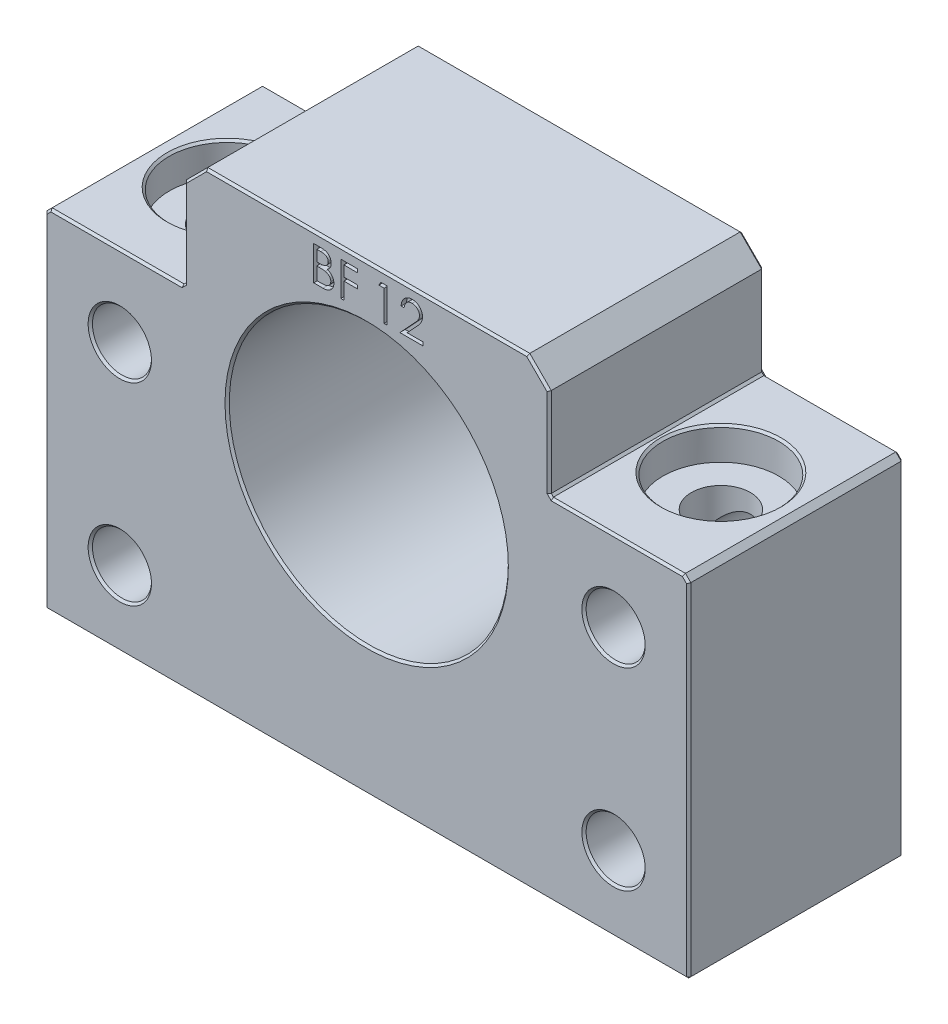
from build123d import *

# Parameters (mm, degrees)
SKETCH2_R           = 2.749999999999998
SKETCH2_R_2         = 2.7499999999999982
BOSS_EXTRUDE1_DEPTH = 20
CHAMFER1_SIZE       = 1.9999999999999996
SKETCH7_R           = 2.7499999999999982
CUT_EXTRUDE4_DEPTH  = 49.541219597369
SKETCH8_R           = 5.400000000000002
CUT_EXTRUDE5_DEPTH  = 3
CHAMFER4_SIZE       = 0.2
CHAMFER5_SIZE       = 0.5
CHAMFER6_SIZE       = 0.2
CUT_EXTRUDE6_DEPTH  = 0.5


with BuildPart() as part:
    # Sketch2 → Boss-Extrude1 (new body)
    # profile 1 of 2: a face of its own
    with BuildSketch(Plane.XY):
        with BuildLine():
            Line((-30, -25.000000000000004), (0, -25.000000000000004))
            Line((0, -25.000000000000004), (0, -13))
            ThreePointArc((-2.795e-13, -13), (-13, 1.59e-15), (-2.7343e-13, 13))
            Line((0, 13), (0, 17.999999999999996))
            Line((0, 17.999999999999996), (-17, 17.999999999999996))
            Line((-17, 17.999999999999996), (-17, 7.4999999999999964))
            Line((-17, 7.4999999999999964), (-29.999999999999996, 7.4999999999999964))
            Line((-29.999999999999996, 7.4999999999999964), (-30, -25.000000000000004))
        make_face()
        with Locations((-23, -18)):
            Circle(SKETCH2_R, mode=Mode.SUBTRACT)
        with Locations((-23.000000000000156, 0)):
            Circle(SKETCH2_R_2, mode=Mode.SUBTRACT)
    # profile 2 of 2: a face of its own
    with BuildSketch(Plane.XY):
        with BuildLine():
            Line((0, -25.000000000000004), (30, -25.000000000000004))
            Line((30, -25.000000000000004), (29.999999999999996, 7.4999999999999964))
            Line((29.999999999999996, 7.4999999999999964), (17, 7.4999999999999964))
            Line((17, 7.4999999999999964), (17, 17.999999999999996))
            Line((17, 17.999999999999996), (0, 17.999999999999996))
            Line((0, 17.999999999999996), (0, 13))
            ThreePointArc((-2.7343e-13, 13), (9.192388155425022, 9.192388155425215), (13, 0))
            ThreePointArc((13, -3.18e-15), (9.192388155425018, -9.192388155425219), (-2.795e-13, -13))
            Line((0, -13), (0, -25.000000000000004))
        make_face()
        with Locations((23, -18)):
            Circle(SKETCH2_R, mode=Mode.SUBTRACT)
        with Locations((23.000000000000156, 0)):
            Circle(SKETCH2_R_2, mode=Mode.SUBTRACT)
    extrude(amount=-BOSS_EXTRUDE1_DEPTH)

    # Chamfer1
    chamfer1_edges = [part.edges().sort_by_distance(p)[0] for p in [
        (-17, 17.999999999999996, -10),
        (17, 17.999999999999996, -10),
    ]]
    chamfer(chamfer1_edges, length=CHAMFER1_SIZE)

    # Sketch7 → Cut-Extrude4 (cut, through all)
    with BuildSketch(Plane(origin=(0, 7.4999999999999964, 0), x_dir=(1, 0, 0), z_dir=(0, 1, 0))):
        with Locations(Location((-23, 10, 0), (0, 0, 270))):
            Circle(SKETCH7_R)
        with Locations((23, 10.000000000000005)):
            Circle(SKETCH7_R)
    extrude(amount=-CUT_EXTRUDE4_DEPTH, mode=Mode.SUBTRACT)

    # Sketch8 → Cut-Extrude5 (cut)
    with BuildSketch(Plane(origin=(0, 7.4999999999999964, 0), x_dir=(1, 0, 0), z_dir=(0, 1, 0))):
        with Locations(Location((-23, 10, 0), (0, 0, 270))):
            Circle(SKETCH8_R)
        with Locations(Location((23, 10, 0), (0, 0, 90))):
            Circle(SKETCH8_R)
    extrude(amount=-CUT_EXTRUDE5_DEPTH, mode=Mode.SUBTRACT)

    # Chamfer4
    chamfer4_edges = [part.edges().sort_by_distance(p)[0] for p in [
        (17, 11.749999999999996, -20),
        (20.250000000000156, 1.56e-15, 0),
        (20.250000000000004, -18, 0),
        (-25.749999999999996, -18, 0),
        (-25.750000000000156, 1.56e-15, 0),
        (23.5, 7.4999999999999964, 0),
        (30, -8.750000000000004, 0),
        (0, -25.000000000000004, 0),
        (-30, -8.750000000000004, 0),
        (-23.5, 7.4999999999999964, 0),
        (-17, 11.749999999999996, 0),
        (17, 11.749999999999996, 0),
        (2.8368e-13, 13, 0),
        (-17, 11.749999999999996, -20),
        (17, 7.4999999999999964, -10),
        (30, -25.000000000000004, -10),
        (-30, -25.000000000000004, -10),
        (-17, 7.4999999999999964, -10),
        (-23.5, 7.4999999999999964, -20),
        (-30, -8.750000000000004, -20),
        (0, -25.000000000000004, -20),
        (30, -8.750000000000004, -20),
        (0, 17.999999999999996, 0),
        (-15.999999999999996, 16.999999999999996, 0),
        (15.999999999999998, 16.999999999999993, 0),
        (0, 17.999999999999996, -20),
        (23.5, 7.4999999999999964, -20),
        (-15.999999999999996, 16.999999999999996, -20),
        (15.999999999999998, 16.999999999999993, -20),
        (-25.750000000000156, 1.56e-15, -20),
        (-25.749999999999996, -18, -20),
        (20.250000000000004, -18, -20),
        (-22.999999999999996, -25.000000000000004, -12.749999999999998),
        (20.250000000000156, 1.56e-15, -20),
        (20.25, -25.000000000000004, -10.000000000000007),
        (1.5461e-13, 12.999999999999998, -20),
        (-23, 7.4999999999999964, -15.400000000000002),
        (23, 7.4999999999999964, -4.599999999999998),
    ]]
    chamfer(chamfer4_edges, length=CHAMFER4_SIZE)

    # Chamfer5
    # the kernel refuses this chamfer: 0.5 mm, written as the material it takes off along each edge
    with BuildSketch(Plane(origin=(29.999999999999996, 7.4999999999999964, 1.0858414939829586), x_dir=(-0.9996219169112968, 0.02749587661058555, 0), z_dir=(0, 0, -1))) as chamfer5_piece_1:
        Polygon((CHAMFER5_SIZE * 0.999621916911, -CHAMFER5_SIZE * 0.0274958766106), (-CHAMFER5_SIZE * 0.0274958766106, -CHAMFER5_SIZE * 0.999621916911), (0, 0), align=None)
    extrude(amount=22.171682987965916, mode=Mode.SUBTRACT)
    with BuildSketch(Plane(origin=(-29.999999999999996, 7.4999999999999964, 1.0858414939829586), x_dir=(-0.0274958766105891, -0.9996219169112968, 0), z_dir=(0, 0, -1))) as chamfer5_piece_2:
        Polygon((CHAMFER5_SIZE * 0.999621916911, -CHAMFER5_SIZE * 0.0274958766106), (-CHAMFER5_SIZE * 0.0274958766106, -CHAMFER5_SIZE * 0.999621916911), (0, 0), align=None)
    extrude(amount=22.171682987965916, mode=Mode.SUBTRACT)

    # Chamfer6
    chamfer6_edges = [part.edges().sort_by_distance(p)[0] for p in [
        (29.7500000000001, 7.250000000000055, -20),
        (-29.750000000000057, 7.250000000000092, -20),
        (-29.750000000000057, 7.250000000000092, 0),
        (29.7500000000001, 7.250000000000055, 0),
    ]]
    chamfer(chamfer6_edges, length=CHAMFER6_SIZE)

    # Sketch9 → Cut-Extrude6 (cut)
    # profile 1 of 4: a face of its own
    with BuildSketch(Plane.XY):
        with BuildLine():
            Line((-4.930877735143601, 16.99907396171437), (-4.311396565271806, 16.99907396171437))
            add(Edge.make_bspline(
                [(-4.311396565271806, 16.99907396171437), (-4.2810721600585975, 16.99891453099277), (-4.222295915681967, 16.998605514575537), (-4.1368254220230405, 16.993812959892196), (-4.056771143799126, 16.987278202216583), (-3.9821098645954276, 16.97690947531791), (-3.9128760845692336, 16.964398363193204), (-3.8488611565034847, 16.94924743002555), (-3.7902686430886647, 16.93108043049201), (-3.7203163750630757, 16.902191303945425), (-3.6405597755515613, 16.859262429799617), (-3.5542012335995707, 16.79582723141444), (-3.480355959323614, 16.718237068440953), (-3.416686942969325, 16.630713516734602), (-3.3660673558934224, 16.534433209503323), (-3.329446636185616, 16.431690945398003), (-3.306261992110262, 16.3238119366567), (-3.3038776267858374, 16.249749911009395), (-3.302672606938472, 16.21232015562463)],
                knots=[0, 0, 0, 0, 1.0015055549973084, 1.9411670181559884, 2.826882275164251, 3.653841531354807, 4.4298951333889205, 5.15006604265673, 5.8255780017582754, 6.453691139883244, 7.647487170613946, 8.808567381836411, 9.977351307845172, 11.170798116227278, 12.373658725454026, 13.556498007963768, 14.765093432906722, 16, 16, 16, 16], degree=3))
            add(Edge.make_bspline(
                [(-3.302672606938472, 16.21232015562463), (-3.3036643122399356, 16.177256765831057), (-3.3056131066796848, 16.108353898247707), (-3.3242483240743974, 16.007575670540387), (-3.35342264473027, 15.911644207747017), (-3.3939766921861336, 15.820909615261689), (-3.4466835030229723, 15.737421980479564), (-3.5091478349548932, 15.660507817710126), (-3.5845103629288477, 15.593423644578992), (-3.640973873489317, 15.555919725836551), (-3.669654778412831, 15.536869434470782)],
                knots=[0, 0, 0, 0, 1.0445528566984863, 2.0526448695526898, 3.0444129344294786, 4.028983337605671, 5.005914585358319, 5.980388655677018, 6.974128948518984, 8, 8, 8, 8], degree=3))
            add(Edge.make_bspline(
                [(-3.669654778412831, 15.536869434470782), (-3.6335863905232664, 15.523021899717502), (-3.5645786296862836, 15.496528135444974), (-3.4696134612658667, 15.449687393104796), (-3.3877938518765154, 15.398740335821191), (-3.318490726589946, 15.343103586047983), (-3.2592201396298526, 15.283133450545513), (-3.2074649712030285, 15.217950596905933), (-3.1633040103570673, 15.146704723688583), (-3.125464429694, 15.070138659466977), (-3.095938058155925, 14.989034220314673), (-3.0738256306205196, 14.90415215914062), (-3.0611551589044708, 14.815796848357172), (-3.0593520843163895, 14.755666539957256), (-3.058441837707703, 14.725310940881037)],
                knots=[0, 0, 0, 0, 1.272689919640753, 2.434971085015314, 3.4836019847500395, 4.442670787500475, 5.356604649251631, 6.2567627995779205, 7.1794929941574654, 8.113709626283116, 9.066344394672267, 10.018646069491881, 10.999752584959689, 12, 12, 12, 12], degree=3))
            add(Edge.make_bspline(
                [(-3.058441837707703, 14.725310940881037), (-3.059327976600299, 14.694316706884758), (-3.0610714796972234, 14.633334683173999), (-3.073934739827122, 14.54374966826033), (-3.0957144297402936, 14.458138109547289), (-3.1257146839425536, 14.375946265237012), (-3.1648690693281685, 14.297333143252903), (-3.212519436971685, 14.222209682350849), (-3.2693352125438326, 14.151330682437568), (-3.332892243664501, 14.083908538622696), (-3.4047943327863845, 14.023286188678778), (-3.4823693390375476, 13.969296940475004), (-3.566594214941073, 13.924895869841679), (-3.6560856666559935, 13.887597764621244), (-3.7518475819881942, 13.859106948870808), (-3.853449947236024, 13.839174685405002), (-3.960805135329182, 13.825744401841987), (-4.034473980980341, 13.824640223115862), (-4.0722539370666775, 13.824073961714372)],
                knots=[0, 0, 0, 0, 0.978564426184269, 1.9253529236192346, 2.8508840810099936, 3.7637620157818192, 4.682927383106882, 5.618979971441264, 6.567305752155091, 7.547517671407923, 8.540179244361411, 9.531824382193507, 10.52620024199815, 11.540722884663378, 12.589160232670231, 13.674978461258942, 14.807647780319936, 16, 16, 16, 16], degree=3))
            Line((-4.0722539370666775, 13.824073961714372), (-4.930877735143601, 13.824073961714372))
            Line((-4.930877735143601, 13.824073961714372), (-4.930877735143601, 16.99907396171437))
        make_face()
        with BuildLine():
            Line((-4.645941837707704, 16.673432936073347), (-4.645941837707704, 15.65580473094514))
            Line((-4.645941837707704, 15.65580473094514), (-4.45450053161796, 15.65580473094514))
            add(Edge.make_bspline(
                [(-4.45450053161796, 15.65580473094514), (-4.426516267249825, 15.65616751824389), (-4.3724449656422415, 15.656868497236658), (-4.294140488049626, 15.658876473428572), (-4.221455650114554, 15.664498984242568), (-4.154515915826009, 15.670119879106405), (-4.093426698799147, 15.67925896934428), (-4.038323338722209, 15.690137537986203), (-3.988341040070849, 15.701642744752268), (-3.93070159519137, 15.72120935072618), (-3.8653211348043706, 15.750126956071576), (-3.7956225331785736, 15.795004978837568), (-3.7341776929086854, 15.84845778495389), (-3.682291672620485, 15.910135300260235), (-3.6398269814981066, 15.978049626002942), (-3.6103323970367414, 16.051117153254463), (-3.5903323606711255, 16.12751684445815), (-3.588525757225675, 16.179966259488893), (-3.5876085043743693, 16.20659599697078)],
                knots=[0, 0, 0, 0, 1.156816543928084, 2.235205307830184, 3.236616183756381, 4.169592531555218, 5.011045266485324, 5.787822927766858, 6.491303610115574, 7.1286397583179575, 8.301311293785723, 9.436451833337234, 10.541879658498347, 11.654887648977027, 12.756523257729588, 13.837046038423123, 14.901820046068316, 15.999999999999998, 15.999999999999998, 15.999999999999998, 15.999999999999998], degree=3))
            add(Edge.make_bspline(
                [(-3.5876085043743693, 16.20659599697078), (-3.588085824969668, 16.224217946843787), (-3.5890221414403745, 16.25878532582256), (-3.596690494517727, 16.309176525664455), (-3.6097239370414282, 16.356569072586232), (-3.626464617337832, 16.40161244409465), (-3.6498586421019557, 16.442898193937356), (-3.677402640954484, 16.481853807174794), (-3.71068180286016, 16.517152657525557), (-3.7485616507695068, 16.55014498814015), (-3.792112330076728, 16.57939538121411), (-3.8413078590842678, 16.605013787807284), (-3.896813823280554, 16.625642920938297), (-3.957694770299405, 16.64370971640013), (-4.0248878282445935, 16.656399097220955), (-4.097617601693824, 16.666970384595594), (-4.176479811096857, 16.672352229128332), (-4.231040011245179, 16.67306466545035), (-4.2592431197589855, 16.673432936073347)],
                knots=[0, 0, 0, 0, 0.9120501202068005, 1.7890859059315984, 2.6304379554914155, 3.453916878380767, 4.269457761309899, 5.079663411285745, 5.918434180364159, 6.77440719109817, 7.675494372791232, 8.627863946308763, 9.638891023094779, 10.73647273835737, 11.911756760973578, 13.17526354205895, 14.539845003690653, 16, 16, 16, 16], degree=3))
            Line((-4.2592431197589855, 16.673432936073347), (-4.645941837707704, 16.673432936073347))
        make_face(mode=Mode.SUBTRACT)
        with BuildLine():
            Line((-4.645941837707704, 15.330163705304116), (-4.645941837707704, 14.149714987355399))
            Line((-4.645941837707704, 14.149714987355399), (-4.240162590912831, 14.149714987355399))
            add(Edge.make_bspline(
                [(-4.240162590912831, 14.149714987355399), (-4.211116850977455, 14.150063101065307), (-4.155135016410968, 14.150734044348619), (-4.074307471944139, 14.152924390271647), (-3.999392799210265, 14.157906668941514), (-3.930732847512852, 14.165749689707907), (-3.8675862226264406, 14.174257282885497), (-3.8107104491645223, 14.185697516293004), (-3.7596444808101945, 14.198804787626809), (-3.7004313587894746, 14.219065072440019), (-3.633753176277468, 14.2505397282007), (-3.5618976136990885, 14.297996205022935), (-3.498010972954164, 14.354532348502575), (-3.443759059245295, 14.419965392074376), (-3.3992972767786, 14.491113810073585), (-3.3669526853813587, 14.5665385203878), (-3.3470038367861523, 14.644993248831662), (-3.344588868930332, 14.6984844809242), (-3.3433777351436005, 14.725310940881037)],
                knots=[0, 0, 0, 0, 1.1600398229285387, 2.23582382828631, 3.2287221572147615, 4.157150950637804, 4.995295830153561, 5.77237494598941, 6.472645481611991, 7.099169576844212, 8.269452707903525, 9.405989375108504, 10.527446680986097, 11.663510218356995, 12.78892351927814, 13.866172445351541, 14.929861264916392, 16, 16, 16, 16], degree=3))
            add(Edge.make_bspline(
                [(-3.3433777351436005, 14.725310940881037), (-3.3436282012211187, 14.742087042633996), (-3.344125093335808, 14.775368646110465), (-3.351618651159405, 14.8242779963738), (-3.3625169473294485, 14.87165432430433), (-3.376606176637195, 14.91762627460123), (-3.397125264641221, 14.961362694573898), (-3.421079773335302, 15.003728587867938), (-3.4491661876843636, 15.044779958488093), (-3.492930538150015, 15.096679645545724), (-3.556586552678862, 15.156475792965248), (-3.6470348418306258, 15.215020527164278), (-3.74987971213133, 15.262235323593632), (-3.8244717949727356, 15.282282705700663), (-3.86300413738719, 15.292638665240013)],
                knots=[0, 0, 0, 0, 0.723448775135655, 1.4352282564902779, 2.130040452222506, 2.8217119647879656, 3.505591118723209, 4.2104545036987995, 4.921174350799147, 5.648778258365409, 7.1379444489649995, 8.670945889131492, 10.280296674528195, 12, 12, 12, 12], degree=3))
            add(Edge.make_bspline(
                [(-3.86300413738719, 15.292638665240013), (-3.8784519600531895, 15.295772919971002), (-3.9119460259697405, 15.30256863072123), (-3.966562902501601, 15.309742047367326), (-4.028916155005806, 15.316132923126599), (-4.099149765060876, 15.320860187578688), (-4.1773525923568675, 15.325746552082988), (-4.263691654307392, 15.327646854101035), (-4.357814361176802, 15.329914040042931), (-4.423121727567978, 15.33007835467656), (-4.45704460213078, 15.330163705304116)],
                knots=[0, 0, 0, 0, 0.6344518841839923, 1.3756225514234535, 2.2164520591327177, 3.1578446069158073, 4.2094185702140665, 5.370758132780898, 6.634282057514016, 8, 8, 8, 8], degree=3))
            Line((-4.45704460213078, 15.330163705304116), (-4.645941837707704, 15.330163705304116))
        make_face(mode=Mode.SUBTRACT)
    # profile 2 of 4: a face of its own
    with BuildSketch(Plane.XY):
        Polygon((-2.4071597864256518, 16.99907396171437), (-0.8603649146307797, 16.99907396171437), (-0.8603649146307797, 16.673432936073347), (-2.1222238889897547, 16.673432936073347), (-2.1222238889897547, 15.69650985915027), (-0.8603649146307797, 15.69650985915027), (-0.8603649146307797, 15.370868833509244), (-2.1222238889897547, 15.370868833509244), (-2.1222238889897547, 13.824073961714372), (-2.4071597864256518, 13.824073961714372), align=None)
    # profile 3 of 4: a face of its own
    with BuildSketch(Plane.XY):
        Polygon((1.3205395324846045, 16.99907396171437), (1.9075838033179378, 16.99907396171437), (1.9075838033179378, 13.824073961714372), (1.6226479058820404, 13.824073961714372), (1.6226479058820404, 16.673432936073347), (1.1341863674205017, 16.673432936073347), align=None)
    # profile 4 of 4: a face of its own
    with BuildSketch(Plane.XY):
        with BuildLine():
            Line((3.4950838033179394, 16.022150884791294), (3.210147905882042, 16.022150884791294))
            add(Edge.make_bspline(
                [(3.210147905882042, 16.022150884791294), (3.2120049661106638, 16.059952332980654), (3.2156521829771227, 16.134193371202176), (3.2327321310931274, 16.242437200578486), (3.257171355414688, 16.345901196564615), (3.2917257458424043, 16.443754618522807), (3.334639297819265, 16.536862679367456), (3.386101536943358, 16.62485555074455), (3.447055958480535, 16.707397557649937), (3.5161863529360304, 16.783723508353688), (3.5912693326502123, 16.85374366186451), (3.6722825777417976, 16.914209489267247), (3.7574134239229453, 16.965297662574184), (3.84640359298441, 17.0080070748001), (3.9402571042133427, 17.040065363601258), (4.038122268110553, 17.063852136671137), (4.140429056139114, 17.078163536004276), (4.210133933281688, 17.07970185580246), (4.24558460459999, 17.080484218124628)],
                knots=[0, 0, 0, 0, 1.1006527102498977, 2.1616526308980437, 3.183658788970421, 4.190468796493721, 5.1759195098875255, 6.163126047456825, 7.151507819852389, 8.156236427250123, 9.156009101557895, 10.134482810578447, 11.092018606748049, 12.041330604570726, 13.001268258454745, 13.972401358723069, 14.968799086320471, 15.999999999999998, 15.999999999999998, 15.999999999999998, 15.999999999999998], degree=3))
            add(Edge.make_bspline(
                [(4.24558460459999, 17.080484218124628), (4.280399000379223, 17.079669189777707), (4.3488080444603945, 17.078067688190096), (4.448650014714085, 17.064314468783397), (4.543697988977296, 17.042773824942806), (4.633766177179307, 17.012551983001465), (4.718135964326083, 16.9719261095811), (4.797441154745056, 16.92312405665549), (4.8726258902483215, 16.866681781053593), (4.940304901096496, 16.800230107425413), (5.002451515832241, 16.729289372941587), (5.056065704427407, 16.653553917521993), (5.101979074149635, 16.57533163690908), (5.140249326613279, 16.494026054045854), (5.1684216812223465, 16.408871621128633), (5.18981048422042, 16.321108087167627), (5.201900352351758, 16.229827008611675), (5.2037558436676665, 16.168044633131224), (5.204699187933324, 16.136634057868218)],
                knots=[0, 0, 0, 0, 1.1116073639947301, 2.1842687618847823, 3.2126211777481792, 4.221274765693213, 5.211760367446714, 6.1966510754446515, 7.192147500201638, 8.207485112727051, 9.220403447888984, 10.201281604222778, 11.166441694673614, 12.114753414831751, 13.065576455818475, 14.026450734285088, 14.99663427856385, 16, 16, 16, 16], degree=3))
            add(Edge.make_bspline(
                [(5.204699187933324, 16.136634057868218), (5.203163156627801, 16.092412807932483), (5.20011804919144, 16.00474632838851), (5.1740700075909976, 15.87591856003746), (5.13338781538298, 15.75110167272312), (5.0844044988125, 15.650647120117943), (5.034990210270832, 15.56969959363835), (4.990460828382313, 15.503052982746869), (4.938332035526816, 15.431293022136488), (4.877845112374948, 15.35466000894726), (4.810251292638208, 15.272553687893566), (4.73493833016469, 15.18502365921072), (4.651369171473851, 15.09297426801682), (4.592714674360984, 15.03010418675786), (4.562321383446144, 14.997526485752834)],
                knots=[0, 0, 0, 0, 1.1844263556738237, 2.3480677057279515, 3.5090691180954448, 4.6961105255979065, 5.333549288062694, 6.050745305391792, 6.8442280559361315, 7.710549037172966, 8.667450064128218, 9.695053472192546, 10.80563445582018, 12, 12, 12, 12], degree=3))
            Line((4.562321383446144, 14.997526485752834), (3.7679353658179395, 14.149714987355399))
            Line((3.7679353658179395, 14.149714987355399), (5.245404316138453, 14.149714987355399))
            Line((5.245404316138453, 14.149714987355399), (5.245404316138453, 13.824073961714372))
            Line((5.245404316138453, 13.824073961714372), (3.088032521266657, 13.824073961714372))
            Line((3.088032521266657, 13.824073961714372), (4.319362649471786, 15.138086381586167))
            add(Edge.make_bspline(
                [(4.319362649471786, 15.138086381586167), (4.3493418039331955, 15.169381273955262), (4.4069256242482, 15.22949235751764), (4.488371247496548, 15.317252042782075), (4.561522329751372, 15.39866769760721), (4.6268523931943815, 15.473585495124711), (4.682944215919092, 15.543101274482073), (4.732721169186007, 15.604963612736674), (4.772604241005456, 15.661890864087418), (4.815888921379272, 15.727876992422354), (4.857811604504806, 15.808442451573104), (4.893836384627163, 15.90689801254563), (4.915802711434128, 16.008250591758845), (4.918437812214412, 16.076741725366013), (4.919763290497427, 16.111193352740013)],
                knots=[0, 0, 0, 0, 1.3296317256158168, 2.553950428173245, 3.673215717877333, 4.687767853392119, 5.6030936323302125, 6.413772471408361, 7.123043291588068, 7.734684054104607, 8.834405431552458, 9.900288307426376, 10.943827017957092, 12, 12, 12, 12], degree=3))
            add(Edge.make_bspline(
                [(4.919763290497427, 16.111193352740013), (4.919186581411526, 16.132857192726963), (4.918049998547729, 16.17555246126901), (4.9080190872497775, 16.23815054266447), (4.892860271006903, 16.29853433805451), (4.871138501206277, 16.356889585397113), (4.842466672700291, 16.412629569771433), (4.807565820917898, 16.465822141098986), (4.767297691960266, 16.51724713095906), (4.720714754781547, 16.565464765626018), (4.669541447528434, 16.60962557345654), (4.6154809496904035, 16.648745279511008), (4.558285497968914, 16.681437901449936), (4.498196244280846, 16.70823807389218), (4.435380711317553, 16.729261455406004), (4.3697174068136695, 16.743828881025536), (4.301387763471684, 16.752975134319986), (4.254730235238033, 16.754212633122577), (4.230956199151273, 16.754843192483605)],
                knots=[0, 0, 0, 0, 0.9914464109930126, 1.953950490212748, 2.8958159495974685, 3.838931463230437, 4.798493297704373, 5.759821559631797, 6.748411867866351, 7.785213222738019, 8.824556873915856, 9.840280684159678, 10.836137866586526, 11.835679397803414, 12.848801642607215, 13.863922112251187, 14.911575586834385, 16, 16, 16, 16], degree=3))
            add(Edge.make_bspline(
                [(4.230956199151273, 16.754843192483605), (4.206126943722321, 16.75419455607275), (4.15736638572315, 16.752920741260933), (4.085775548702145, 16.744010181782457), (4.017480593376929, 16.728637883708085), (3.952309724269637, 16.707613329085586), (3.8901526714252372, 16.680890216939616), (3.831311717191377, 16.647605562838166), (3.77591895336274, 16.60788767976407), (3.7238702500421836, 16.56285660367011), (3.67591506903454, 16.512720993995668), (3.63378111735708, 16.456831956070648), (3.596965618812498, 16.39620994355544), (3.5648443855843954, 16.331018529824675), (3.5387588667235983, 16.260666172267296), (3.518826080261097, 16.18540261144049), (3.5030537264493495, 16.105554643992672), (3.4977845684720927, 16.050413888444204), (3.4950838033179394, 16.022150884791294)],
                knots=[0, 0, 0, 0, 1.031018745523886, 2.024750580346834, 2.99019445498513, 3.934040569431279, 4.864654155060268, 5.795059489162553, 6.735614924666316, 7.69056453247464, 8.649604399260106, 9.611025573591256, 10.590972636115133, 11.591080094623736, 12.624614302107906, 13.701020112815884, 14.821632451293812, 16, 16, 16, 16], degree=3))
        make_face()
    extrude(amount=-CUT_EXTRUDE6_DEPTH, mode=Mode.SUBTRACT)


solid = part.part
